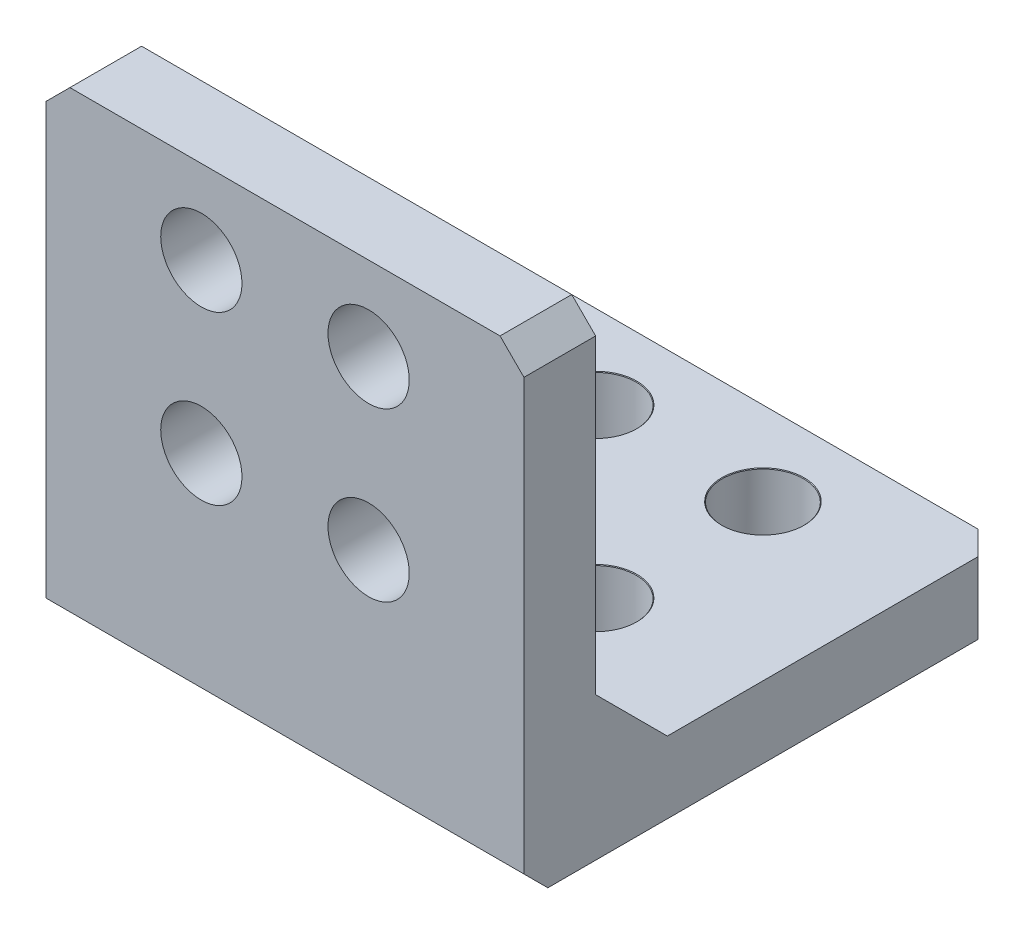
from build123d import *

# Parameters (mm, degrees)
EXTRUDE_THIN1_DEPTH            = 20
CHAMFER1_SIZE                  = 3
M3_CLEARANCE_HOLE1_D           = 3.4
M3_CLEARANCE_HOLE1_DEPTH       = 6
M3_CLEARANCE_HOLE1_CSINK_D     = 3.45
M3_CLEARANCE_HOLE1_CSINK_ANGLE = 90
M3_CLEARANCE_HOLE1_TIP         = 1.021463052
CHAMFER2_SIZE                  = 1


# Read off the part's stored shape, not the designer's step: M3 Clearance Hole2
with BuildPart() as part:
    # Sketch2 → Extrude-Thin1 (new body)
    with BuildSketch(Plane(origin=(0, 0, 0), x_dir=(0, 0, -1), z_dir=(1, 0, 0))):
        Polygon((-10, 20), (-10, 0), (10, 0), (10, 3), (-7, 3), (-7, 20), align=None)
    extrude(amount=EXTRUDE_THIN1_DEPTH)

    # Chamfer1
    chamfer1_edges = [part.edges().sort_by_distance(p)[0] for p in [
        (10, 3, 7),
    ]]
    chamfer(chamfer1_edges, length=CHAMFER1_SIZE)

    # M3 Clearance Hole1
    with Locations(Plane(origin=(0, 3, 0), x_dir=(1, 0, 0), z_dir=(0, 1, 0))):
        with Locations((6.5, 6.5), (13.5, 6.5), (13.5, -0.5), (6.5, -0.5)):
            CounterSinkHole(M3_CLEARANCE_HOLE1_D / 2, M3_CLEARANCE_HOLE1_CSINK_D / 2, depth=M3_CLEARANCE_HOLE1_DEPTH, counter_sink_angle=M3_CLEARANCE_HOLE1_CSINK_ANGLE)
            with Locations((0, 0, -(M3_CLEARANCE_HOLE1_DEPTH + M3_CLEARANCE_HOLE1_TIP / 2))):  # 118° drill point
                Cone(0, M3_CLEARANCE_HOLE1_D / 2, M3_CLEARANCE_HOLE1_TIP, mode=Mode.SUBTRACT)

    # M3 Clearance Hole2 outline → M3 Clearance Hole2 (revolve, cut)
    with BuildSketch(Plane(origin=(6.5, 9.5, 0), x_dir=(1, 0, 0), z_dir=(0, -1, 0))):
        Polygon((1.7, 7.025), (1.7, 10), (0, 10), (0, 7), (1.725, 7), align=None)
    revolve(axis=Axis((6.5, 9.5, 0), (0, 0, 1)), mode=Mode.SUBTRACT)

    # M3 Clearance Hole2 2 outline → M3 Clearance Hole2 2 (revolve, cut)
    with BuildSketch(Plane(origin=(13.5, 16.5, 0), x_dir=(1, 0, 0), z_dir=(0, -1, 0))):
        Polygon((1.7, 7.025), (1.7, 10), (0, 10), (0, 7), (1.725, 7), align=None)
    revolve(axis=Axis((13.5, 16.5, 0), (0, 0, 1)), mode=Mode.SUBTRACT)

    # M3 Clearance Hole2 3 outline → M3 Clearance Hole2 3 (revolve, cut)
    with BuildSketch(Plane(origin=(13.5, 9.5, 0), x_dir=(1, 0, 0), z_dir=(0, -1, 0))):
        Polygon((1.7, 7.025), (1.7, 10), (0, 10), (0, 7), (1.725, 7), align=None)
    revolve(axis=Axis((13.5, 9.5, 0), (0, 0, 1)), mode=Mode.SUBTRACT)

    # M3 Clearance Hole2 4 outline → M3 Clearance Hole2 4 (revolve, cut)
    with BuildSketch(Plane(origin=(6.5, 16.5, 0), x_dir=(1, 0, 0), z_dir=(0, -1, 0))):
        Polygon((1.7, 7.025), (1.7, 10), (0, 10), (0, 7), (1.725, 7), align=None)
    revolve(axis=Axis((6.5, 16.5, 0), (0, 0, 1)), mode=Mode.SUBTRACT)

    # Chamfer2
    chamfer2_edges = [part.edges().sort_by_distance(p)[0] for p in [
        (20, 1.5, -10),
        (0, 1.5, -10),
        (0, 20, 8.5),
        (20, 20, 8.5),
        (10, 0, 10),
    ]]
    chamfer(chamfer2_edges, length=CHAMFER2_SIZE)


solid = part.part
